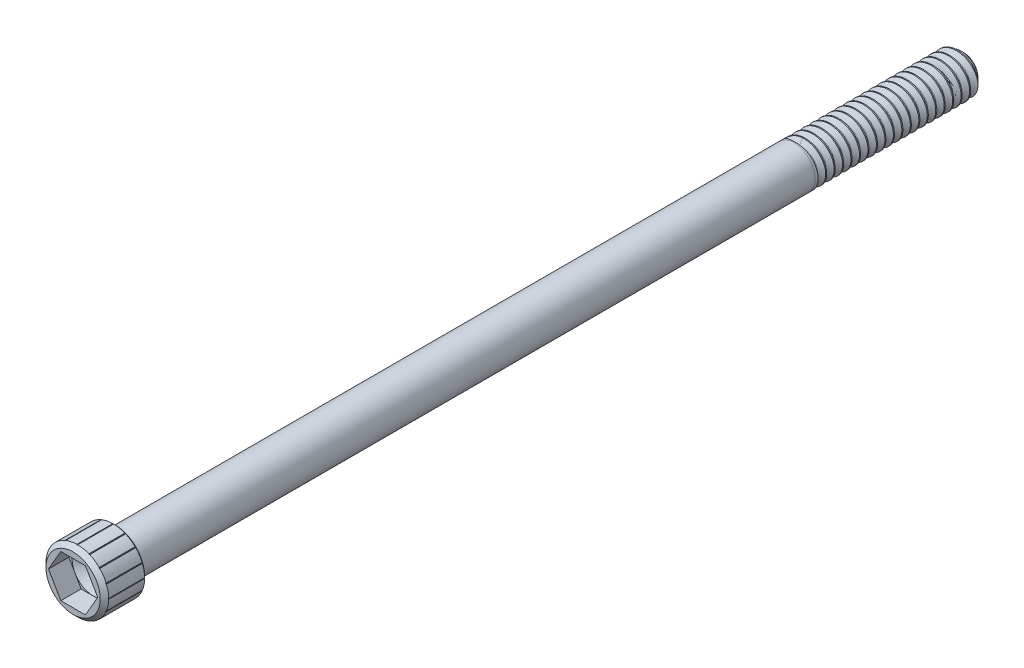
from build123d import *

# Parameters (mm, degrees)
CUT_EXTRUDE1_DEPTH = 3.048
CUT_SWEEP1_PITCH   = 1.27
CUT_EXTRUDE2_DEPTH = 134.616955403
CUT_EXTRUDE3_REACH = 135.617
CIRPATTERN1_COUNT  = 16


with BuildPart() as part:
    # Sketch1 → Revolve1 (revolve)
    with BuildSketch(Plane(origin=(0, 0, 0), x_dir=(0, 0, -1), z_dir=(1, 0, 0)), mode=Mode.PRIVATE) as revolve1_sk:
        with BuildLine():
            Line((4.892085627, 0), (133.4516, 0))
            Line((133.4516, 0), (133.4516, 2.159))
            Line((133.4516, 2.159), (132.487035, 3.123565))
            Line((132.487035, 3.123565), (114.4016, 3.123565))
            Line((114.4016, 3.123565), (108.0516, 3.133725))
            Line((108.0516, 3.133725), (6.4516, 3.133725))
            ThreePointArc((6.4516, 3.133725), (6.325876414, 3.185801414), (6.2738, 3.311525))
            Line((6.2738, 3.311525), (6.2738, 4.445))
            Line((6.2738, 4.445), (6.0198, 4.699))
            Line((6.0198, 4.699), (0.635, 4.699))
            Line((0.635, 4.699), (0, 4.064))
            Line((0, 4.064), (0, 3.19405))
            Line((0, 3.19405), (3.048, 3.19405))
            Line((3.048, 3.19405), (4.892085627, 0))
        make_face()
    revolve(revolve1_sk.sketch.rotate(Axis((0, 0, -4.892085627), (0, 0, -1)), 180), axis=Axis((0, 0, -4.892085627), (0, 0, -1)))

    # Sketch2 → Cut-Extrude1 (cut)
    with BuildSketch(Plane.XY):
        Polygon((-1.844085627, 3.19405), (1.844085627, 3.19405), (3.688171255, 0), (1.844085627, -3.19405), (-1.844085627, -3.19405), (-3.688171255, 0), align=None)
    extrude(amount=-CUT_EXTRUDE1_DEPTH, mode=Mode.SUBTRACT)

    # Cut-Sweep1: arcs per turn and ends read off the stored shape
    # Cut-Sweep1: the profile of Sketch4 screwed along a right-hand helix through 20 turns, 8 arcs to a turn; built about Z, then put on its axis
    cut_sweep1_z = Axis((0, 0, 0), (0, 0, 1))
    cut_sweep1_corners = [(3.157238817, 0, -0.138041556), (2.364740567, 0, -0.595590912), (2.296160599, 0, -0.714374629), (2.364740031, 0, -0.833158655), (3.157238817, 0, -1.290708456)]
    with BuildLine(mode=Mode.PRIVATE) as cut_sweep1_profile:
        Line(cut_sweep1_corners[0], cut_sweep1_corners[1])
        Line(cut_sweep1_corners[3], cut_sweep1_corners[4])
        Line(cut_sweep1_corners[4], cut_sweep1_corners[0])
        ThreePointArc((2.364740567, 0, -0.595590912), (2.314536623, 0, -0.64579482), (2.296160599, 0, -0.714374629))
        ThreePointArc((2.296160599, 0, -0.714374629), (2.314536313, 0, -0.782954521), (2.364740031, 0, -0.833158655))
    cut_sweep1_cap = Face(cut_sweep1_profile.wire())
    cut_sweep1_arcs = [((2.364740567, 0, -0.595590912), (2.296160777, 0, -0.635185496), (2.296160599, 0, -0.714374629), (1, 0.8660260337256446, 1)), ((2.296160599, 0, -0.714374629), (2.29616042, 0, -0.793563761), (2.364740031, 0, -0.833158655), (1, 0.8660260337256446, 1))]  # start, shoulder, end, weights
    cut_sweep1_turn_angles = [0, 22.5, 45, 67.5, 90, 112.5, 135, 157.5, 180, 202.5, 225, 247.5, 270, 292.5, 315, 337.5, 360]
    cut_sweep1_turn_weights = [1, 0.9238795325112867, 1, 0.9238795325112867, 1, 0.9238795325112867, 1, 0.9238795325112867, 1, 0.9238795325112867, 1, 0.9238795325112867, 1, 0.9238795325112867, 1, 0.9238795325112867, 1]
    cut_sweep1_turn_rails = [Edge.make_bspline([Vector(p[0], p[1], 0).rotate(cut_sweep1_z, cut_sweep1_turn_angles[k]) / cut_sweep1_turn_weights[k] + Vector(0, 0, p[2] + CUT_SWEEP1_PITCH * cut_sweep1_turn_angles[k] / 360) for k in range(17)], [0, 0, 0, 1, 1, 2, 2, 3, 3, 4, 4, 5, 5, 6, 6, 7, 7, 8, 8, 8], 2, cut_sweep1_turn_weights) for p in cut_sweep1_corners]
    cut_sweep1_turn_sides = [*[Face.make_surface_from_curves(cut_sweep1_turn_rails[p[0]], cut_sweep1_turn_rails[p[1]]) for p in [(0, 1), (3, 4), (4, 0)]], *[Face.make_bezier_surface([[Vector(p[j][0], p[j][1], 0).rotate(cut_sweep1_z, cut_sweep1_turn_angles[2 * i + k]) / cut_sweep1_turn_weights[2 * i + k] + Vector(0, 0, p[j][2] + CUT_SWEEP1_PITCH * cut_sweep1_turn_angles[2 * i + k] / 360) for k in range(3)] for j in range(3)], [[p[3][j] * cut_sweep1_turn_weights[2 * i + k] for k in range(3)] for j in range(3)]) for p in cut_sweep1_arcs for i in range(8)]]
    cut_sweep1 = Plane(origin=(0, 0, -133.4516), x_dir=(0, 1, 0), z_dir=(0, 0, 1)) * Solid(Shell([*[p.moved(Location((0, 0, CUT_SWEEP1_PITCH * i))) for i in range(20) for p in cut_sweep1_turn_sides], cut_sweep1_cap, cut_sweep1_cap.rotate(cut_sweep1_z, 7200).moved(Location((0, 0, CUT_SWEEP1_PITCH * 7200 / 360)))]))
    add(cut_sweep1, mode=Mode.SUBTRACT)

    # Sketch5 → Cut-Extrude2 (cut, through all)
    with BuildSketch(Plane(origin=(0, 0, 0), x_dir=(0, 0, -1), z_dir=(1, 0, 0))):
        with BuildLine():
            Line((108.203357461, 3.133482188), (108.647190912, 2.364740567))
            ThreePointArc((108.647190912, 2.364740567), (108.765974629, 2.296160599), (108.884758655, 2.364740031))
            Line((108.884758655, 2.364740031), (109.327554058, 3.131683474))
            Line((109.327554058, 3.131683474), (108.203357461, 3.133482188))
        make_face()
    extrude(amount=-CUT_EXTRUDE2_DEPTH, mode=Mode.SUBTRACT)

    # Cut-Extrude3: up to this cone (the profile starts inside it)
    cut_extrude3_end = Plane(origin=(0, 0, 0), z_dir=(0, 0, 1)).offset(-10.718799) * Cone(1e-06, 157.5546, 157.554599, align=(Align.CENTER, Align.CENTER, Align.MIN), mode=Mode.PRIVATE)
    # Sketch6 → Cut-Extrude3 (cut, up to the surface)
    with BuildSketch(Plane.XY, mode=Mode.PRIVATE) as cut_extrude3_sk1:
        with BuildLine():
            Line((0.017960512, 4.653460512), (0.063076629, 4.698576629))
            ThreePointArc((0.063076629, 4.698576629), (0, 4.699), (-0.063076629, 4.698576629))
            Line((-0.063076629, 4.698576629), (-0.017960512, 4.653460512))
            ThreePointArc((-0.017960512, 4.653460512), (0, 4.646021024), (0.017960512, 4.653460512))
        make_face()
    cut_extrude3_tool1 = extrude(cut_extrude3_sk1.sketch, amount=-CUT_EXTRUDE3_REACH, mode=Mode.PRIVATE) & cut_extrude3_end
    cut_extrude3 = cut_extrude3_tool1.solids().sort_by_distance((0, 4.678961, 0))[0]
    add(cut_extrude3, mode=Mode.SUBTRACT)

    # CirPattern1: Cut-Extrude3 ×16 about axis
    cirpattern1_axis = Axis((0, 0, 0), (0, 0, 1))
    for i in range(1, CIRPATTERN1_COUNT):
        add(cut_extrude3.rotate(cirpattern1_axis, i * 360 / CIRPATTERN1_COUNT), mode=Mode.SUBTRACT)


solid = part.part
